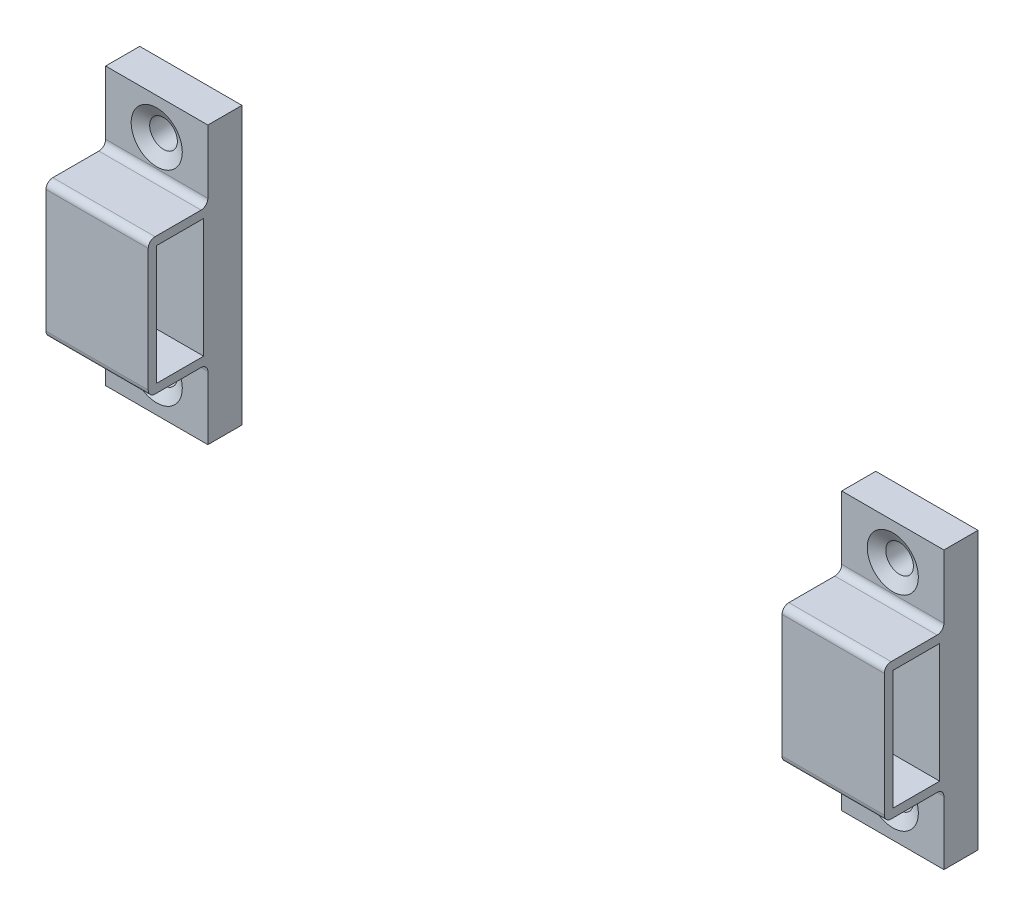
from build123d import *

# Parameters (mm, degrees)
BOSS_EXTRUDE1_DEPTH      = 3.175
BOSS_EXTRUDE1_DEPTH_BACK = 3.175
SKETCH4_W                = 203.2
SKETCH4_H                = 19.05
CHAMFER1_SIZE            = 1.27
SKETCH5_R                = 7.9375
BOSS_EXTRUDE2_DEPTH      = 12.7
BOSS_EXTRUDE3_DEPTH      = 3.175
CHAMFER2_SIZE            = 1.27
FILLET1_R                = 0.635
FILLET2_R                = 0.254
SKETCH7_W                = 8.73125
SKETCH7_H                = 22.225
BOSS_EXTRUDE4_DEPTH      = 9.525
SKETCH8_R                = 2.5796875
CUT_EXTRUDE1_DEPTH       = 157.452333308
FILLET4_R                = 1.27
PATTERN_LINEAR_1_COUNT   = 2
PATTERN_LINEAR_1_PITCH   = 137.16


with BuildPart() as part:
    # Sketch4 → Boss-Extrude1 (new, two sides: drawn at the far end of the back side and taken through both)
    with BuildSketch(Plane.XY.offset(-BOSS_EXTRUDE1_DEPTH_BACK)):
        with Locations((-50.8, 0)):
            Rectangle(SKETCH4_W, SKETCH4_H)
    extrude(amount=BOSS_EXTRUDE1_DEPTH + BOSS_EXTRUDE1_DEPTH_BACK)

    # Chamfer1
    chamfer1_edges = [part.edges().sort_by_distance(p)[0] for p in [
        (50.8, 0, 3.175),
        (50.8, 0, -3.175),
        (50.8, 9.525, 0),
        (50.8, -9.525, 0),
    ]]
    chamfer(chamfer1_edges, length=CHAMFER1_SIZE)

    # Sketch5 → Boss-Extrude2 (add)
    with BuildSketch(Plane.XY.offset(3.175)):
        with Locations((-142.875, 0)):
            Circle(SKETCH5_R)
    extrude(amount=BOSS_EXTRUDE2_DEPTH)

    # Sketch6 → Boss-Extrude3 (add)
    with BuildSketch(Plane.XY.offset(15.875)):
        Polygon((-151.892, -9.525), (-133.858, -9.525), (-133.35, -9.017), (-133.35, 9.017), (-133.858, 9.525), (-151.892, 9.525), (-152.4, 9.017), (-152.4, -9.017), align=None)
    extrude(amount=BOSS_EXTRUDE3_DEPTH)

    # Chamfer2
    # the kernel refuses this chamfer: 1.27 mm, written as the material it takes off along each edge
    with BuildSketch(Plane(origin=(-130.591962605, 9.525, 19.05), x_dir=(0, -0.9996219169112966, 0.027495876610587302), z_dir=(-1, 0, 0)), Plane(origin=(-133.35, -12.283037395, 19.05), x_dir=(-0.9996219169112966, 0, 0.027495876610586965), z_dir=(0, 1, 0)), Plane(origin=(-152.4, 12.283037395, 19.05), x_dir=(0.9996219169112966, 0, 0.027495876610586965), z_dir=(0, -1, 0))) as chamfer2_piece_1:
        Polygon((CHAMFER2_SIZE * 0.999621916911, -CHAMFER2_SIZE * 0.0274958766106), (-CHAMFER2_SIZE * 0.0274958766106, -CHAMFER2_SIZE * 0.999621916911), (0, 0), align=None)
    extrude(amount=24.566074789, mode=Mode.SUBTRACT)
    with BuildSketch(Plane(origin=(-155.158037395, -9.525, 19.05), x_dir=(0, -0.02749587661058591, -0.9996219169112968), z_dir=(1, 0, 0))) as chamfer2_piece_2:
        Polygon((CHAMFER2_SIZE * 0.999621916911, CHAMFER2_SIZE * 0.0274958766106), (-CHAMFER2_SIZE * 0.0274958766106, CHAMFER2_SIZE * 0.999621916911), (0, 0), align=None)
    extrude(amount=24.566074789, mode=Mode.SUBTRACT)

    # Fillet1
    fillet1_edges = [part.edges().sort_by_distance(p)[0] for p in [
        (-150.8125, 0, 3.175),
        (-150.8125, 0, 15.875),
    ]]
    fillet(fillet1_edges, radius=FILLET1_R)

    # Fillet2
    fillet2_edges = [part.edges().sort_by_distance(p)[0] for p in [
        (-152.146, 9.271, 15.875),
        (-152.4, 0, 15.875),
        (-152.146, -9.271, 15.875),
        (-142.875, -9.525, 15.875),
        (-133.604, -9.271, 15.875),
        (-133.35, 0, 15.875),
        (-133.604, 9.271, 15.875),
        (-142.875, 9.525, 15.875),
    ]]
    fillet(fillet2_edges, radius=FILLET2_R)


with BuildPart() as body_2:
    # Sketch7 → Boss-Extrude4 (new, symmetric)
    with BuildSketch(Plane(origin=(127, 0, 0), x_dir=(0, 0, -1), z_dir=(1, 0, 0))):
        Polygon((11.509375, 25.796875), (11.509375, -25.796875), (5.159375, -25.796875), (5.159375, -12.7), (-5.953125, -12.7), (-5.953125, 12.7), (5.159375, 12.7), (5.159375, 25.796875), align=None)
        Rectangle(SKETCH7_W, SKETCH7_H, mode=Mode.SUBTRACT)
    extrude(amount=BOSS_EXTRUDE4_DEPTH, both=True)

    # Sketch8 → Cut-Extrude1 (cut, through all)
    with BuildSketch(Plane.XY.offset(-5.159375)):
        with Locations((127, 19.05)):
            Circle(SKETCH8_R)
        with Locations((127, -19.05)):
            Circle(SKETCH8_R)
    extrude(amount=-CUT_EXTRUDE1_DEPTH, mode=Mode.SUBTRACT)

    # Cut-Extrude2 cone 1 section (through the dimple's axis) → Cut-Extrude2 (revolve, cut)
    with BuildSketch(Plane(origin=(127, 19.05, -5.159375), x_dir=(0, -1, 0), z_dir=(1, 0, 0))):
        Polygon((0, 0), (4.7625, 0), (0, 2.749630657), align=None)
    revolve(axis=Axis((127, 19.05, -5.159375), (0, 0, -1)), mode=Mode.SUBTRACT)

    # Cut-Extrude3 cone 1 section (through the dimple's axis) → Cut-Extrude3 (revolve, cut)
    with BuildSketch(Plane(origin=(127, -19.05, -5.159375), x_dir=(0, -1, 0), z_dir=(1, 0, 0))):
        Polygon((0, 0), (4.7625, 0), (0, 2.749630657), align=None)
    revolve(axis=Axis((127, -19.05, -5.159375), (0, 0, -1)), mode=Mode.SUBTRACT)

    # Fillet4
    fillet4_edges = [body_2.edges().sort_by_distance(p)[0] for p in [
        (127, -12.7, -5.159375),
        (127, -12.7, 5.953125),
        (127, 12.7, 5.953125),
        (127, 12.7, -5.159375),
    ]]
    fillet(fillet4_edges, radius=FILLET4_R)


with BuildPart() as pattern_linear_1_1:
    # 阵列(线性)1: pattern copy
    add(body_2.part.moved(Location(Vector(-1, 0, 0) * (1 * PATTERN_LINEAR_1_PITCH))))


solid = Compound([body_2.part, pattern_linear_1_1.part])
